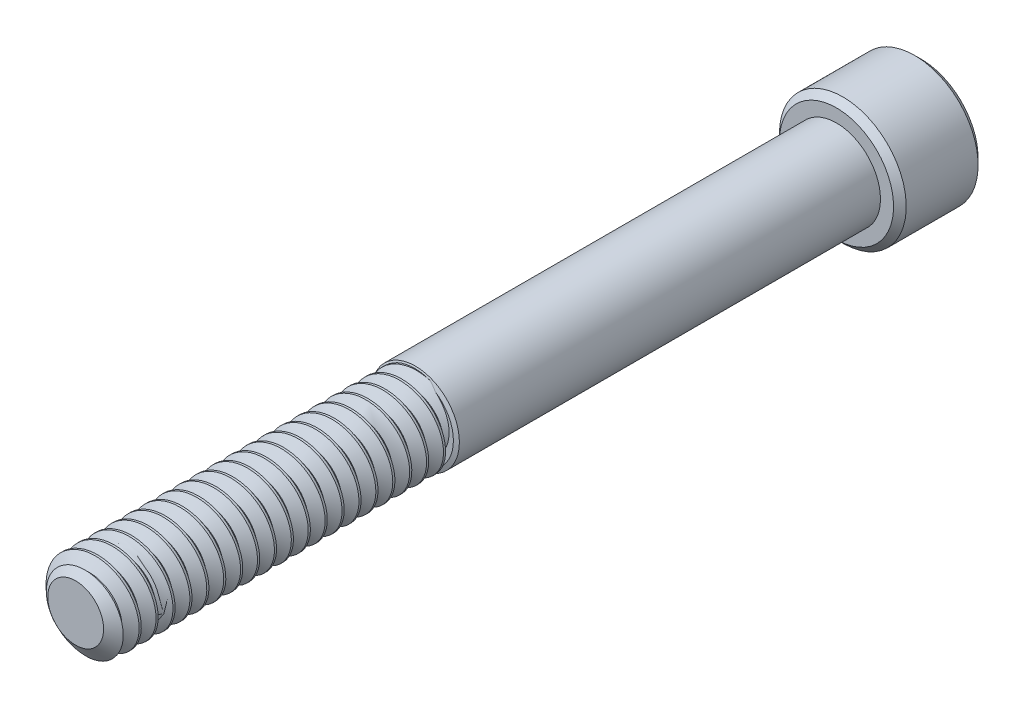
from build123d import *

# Parameters (mm, degrees)
SKETCH1_R          = 3.175
EXTRUDE1_DEPTH     = 57.15
CUT_SWEEP1_PITCH   = 1.27
SKETCH6_R          = 4.7625
EXTRUDE2_DEPTH     = 6.35
CUT_EXTRUDE1_DEPTH = 3.571875
CHAMFER1_SIZE      = 0.47625


with BuildPart() as part:
    # Sketch1 → Extrude1 (new body)
    with BuildSketch(Plane.XY):
        Circle(SKETCH1_R)
    extrude(amount=-EXTRUDE1_DEPTH)

    # Cut-Sweep1: arcs per turn and ends read off the stored shape
    # Cut-Sweep1: the profile of Sketch3 profile screwed along a right-hand helix through 48 turns, 6 arcs to a turn; built about Z, then put on its axis
    cut_sweep1_z = Axis((0, 0, 0), (0, 0, 1))
    cut_sweep1_corners = [(3.1756, 0, -2.38159641), (2.350110803, 0, -1.905), (2.350110803, 0, -1.74625), (3.1756, 0, -1.26965359)]
    with BuildLine(mode=Mode.PRIVATE) as cut_sweep1_profile:
        Line(cut_sweep1_corners[0], cut_sweep1_corners[1])
        Line(cut_sweep1_corners[1], cut_sweep1_corners[2])
        Line(cut_sweep1_corners[2], cut_sweep1_corners[3])
        Line(cut_sweep1_corners[3], cut_sweep1_corners[0])
    cut_sweep1_cap = Face(cut_sweep1_profile.wire())
    cut_sweep1_turn_angles = [0, 30, 60, 90, 120, 150, 180, 210, 240, 270, 300, 330, 360]
    cut_sweep1_turn_weights = [1, 0.8660254037844387, 1, 0.8660254037844387, 1, 0.8660254037844387, 1, 0.8660254037844387, 1, 0.8660254037844387, 1, 0.8660254037844387, 1]
    cut_sweep1_turn_rails = [Edge.make_bspline([Vector(p[0], p[1], 0).rotate(cut_sweep1_z, cut_sweep1_turn_angles[k]) / cut_sweep1_turn_weights[k] + Vector(0, 0, p[2] + CUT_SWEEP1_PITCH * cut_sweep1_turn_angles[k] / 360) for k in range(13)], [0, 0, 0, 1, 1, 2, 2, 3, 3, 4, 4, 5, 5, 6, 6, 6], 2, cut_sweep1_turn_weights) for p in cut_sweep1_corners]
    cut_sweep1_turn_sides = [Face.make_surface_from_curves(cut_sweep1_turn_rails[p[0]], cut_sweep1_turn_rails[p[1]]) for p in [(0, 1), (1, 2), (2, 3), (3, 0)]]
    cut_sweep1 = Plane(origin=(0, 0, 0), x_dir=(0, 1, 0), z_dir=(0, 0, -1)) * Solid(Shell([*[p.moved(Location((0, 0, CUT_SWEEP1_PITCH * i))) for i in range(48) for p in cut_sweep1_turn_sides], cut_sweep1_cap, cut_sweep1_cap.rotate(cut_sweep1_z, 17280).moved(Location((0, 0, CUT_SWEEP1_PITCH * 17280 / 360)))]))
    add(cut_sweep1, mode=Mode.SUBTRACT)

    # Sketch4 → Cut-Revolve1 (revolve, cut)
    with BuildSketch(Plane(origin=(0, 0, 0), x_dir=(0, 0, -1), z_dir=(1, 0, 0)), mode=Mode.PRIVATE) as cut_revolve1_sk:
        Polygon((0.755446349, 3.175), (0, 2.096110803), (0, 3.175), align=None)
    revolve(cut_revolve1_sk.sketch.rotate(Axis((0, 0, 0), (0, 0, -1)), 270), axis=Axis((0, 0, 0), (0, 0, -1)), mode=Mode.SUBTRACT)

    # Sketch5 → partially thread (revolve)
    with BuildSketch(Plane(origin=(0, 0, 0), x_dir=(0, 0, -1), z_dir=(1, 0, 0)), mode=Mode.PRIVATE) as partially_thread_sk:
        Polygon((57.15, 3.302), (25.520182971, 3.302), (25.4, 2.9718), (25.4, 0), (57.15, 0), align=None)
    revolve(partially_thread_sk.sketch.rotate(Axis((0, 0, 0), (0, 0, -1)), 270), axis=Axis((0, 0, 0), (0, 0, -1)))

    # Sketch6 → Extrude2 (add)
    with BuildSketch(Plane(origin=(0, 0, -57.15), x_dir=(-1, 0, 0), z_dir=(0, 0, -1))):
        Circle(SKETCH6_R)
    extrude(amount=EXTRUDE2_DEPTH)

    # Sketch7 → Cut-Extrude1 (cut)
    with BuildSketch(Plane(origin=(0, 0, -63.5), x_dir=(-1, 0, 0), z_dir=(0, 0, -1))):
        Polygon((0, 2.749630657), (-2.38125, 1.374815329), (-2.38125, -1.374815329), (0, -2.749630657), (2.38125, -1.374815329), (2.38125, 1.374815329), align=None)
    extrude(amount=-CUT_EXTRUDE1_DEPTH, mode=Mode.SUBTRACT)

    # Cut-Extrude2 cone 1 section (through the dimple's axis) → Cut-Extrude2 (revolve, cut)
    with BuildSketch(Plane(origin=(0, 0, -63.5), x_dir=(0, 1, 0), z_dir=(1, 0, 0))):
        Polygon((0, 0), (2.749630657, 0), (0, 2.749630657), align=None)
    revolve(axis=Axis((0, 0, -63.5), (0, 0, 1)), mode=Mode.SUBTRACT)

    # Chamfer1
    chamfer1_edges = [part.edges().sort_by_distance(p)[0] for p in [
        (4.7625, 0, -57.15),
        (4.7625, 0, -63.5),
    ]]
    chamfer(chamfer1_edges, length=CHAMFER1_SIZE)


solid = part.part
